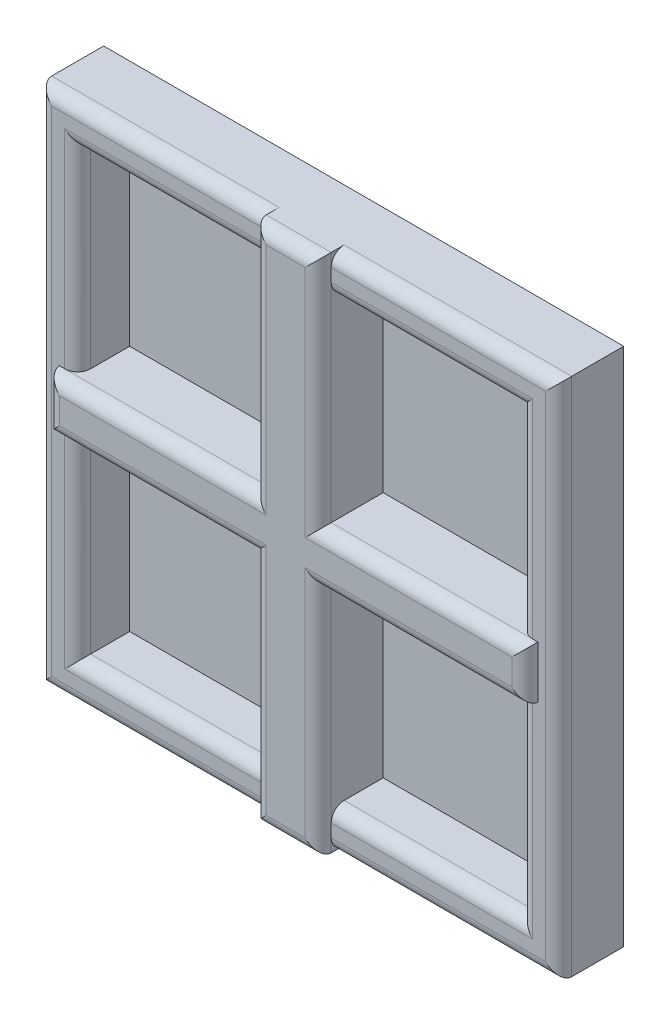
from build123d import *

# Parameters (mm, degrees)
SKETCH1_W           = 400
SKETCH1_H           = 400
SKETCH1_W_2         = 340
SKETCH1_H_2         = 340
BOSS_EXTRUDE1_DEPTH = 50
FILLET1_R           = 10
SKETCH2_W           = 50
SKETCH2_H           = 400
SKETCH2_W_2         = 368
SKETCH2_H_2         = 40
BOSS_EXTRUDE2_DEPTH = 60
FILLET2_R           = 10
SKETCH4_W           = 360
SKETCH4_H           = 360
BOSS_EXTRUDE3_DEPTH = 10
SCALE1_SCALE        = 0.25
SCALE2_SCALE        = 0.32


with BuildPart() as part:
    # Sketch1 → Boss-Extrude1 (new body)
    with BuildSketch(Plane.XY):
        with Locations((-200, 200)):
            Rectangle(SKETCH1_W, SKETCH1_H)
        with Locations((-200, 200)):
            Rectangle(SKETCH1_W_2, SKETCH1_H_2, mode=Mode.SUBTRACT)
    extrude(amount=BOSS_EXTRUDE1_DEPTH)

    # Fillet1
    fillet1_edges = [part.edges().sort_by_distance(p)[0] for p in [
        (-400, 200, 50),
        (-200, 0, 50),
        (-200, 30, 50),
        (-30, 200, 50),
        (-200, 370, 50),
        (-370, 200, 50),
        (0, 200, 50),
        (-200, 400, 50),
    ]]
    fillet(fillet1_edges, radius=FILLET1_R)

    # Sketch2 → Boss-Extrude2 (add)
    with BuildSketch(Plane.XY):
        with Locations((-200, 200)):
            Rectangle(SKETCH2_W, SKETCH2_H)
        with Locations((-200, 200)):
            Rectangle(SKETCH2_W_2, SKETCH2_H_2)
    extrude(amount=BOSS_EXTRUDE2_DEPTH)

    # Fillet2
    fillet2_edges = [part.edges().sort_by_distance(p)[0] for p in [
        (-200, 0, 60),
        (-225, 90, 60),
        (-304.5, 180, 60),
        (-384, 200, 60),
        (-304.5, 220, 60),
        (-225, 310, 60),
        (-200, 400, 60),
        (-175, 310, 60),
        (-95.5, 220, 60),
        (-16, 200, 60),
        (-95.5, 180, 60),
        (-175, 90, 60),
    ]]
    fillet(fillet2_edges, radius=FILLET2_R - 0.0001)  # a hair under: the kernel refuses the full size


with BuildPart() as body_2:
    # Sketch4 → Boss-Extrude3 (new body)
    with BuildSketch(Plane.XY):
        with Locations((-200, 200)):
            Rectangle(SKETCH4_W, SKETCH4_H)
    extrude(amount=BOSS_EXTRUDE3_DEPTH)


with BuildPart() as part_1:
    # Scale1: scaled about (0, 0, 0)
    add(part.part.scale(SCALE1_SCALE))


with BuildPart() as body_2_1:
    # Scale1: scaled about (0, 0, 0)
    add(body_2.part.scale(SCALE1_SCALE))


with BuildPart() as body_2_2:
    # Scale2: scaled about (0, 0, 0)
    add(body_2_1.part.scale(SCALE2_SCALE))


with BuildPart() as part_2:
    # Scale2: scaled about (0, 0, 0)
    add(part_1.part.scale(SCALE2_SCALE))


solid = Compound([body_2_2.part, part_2.part])
